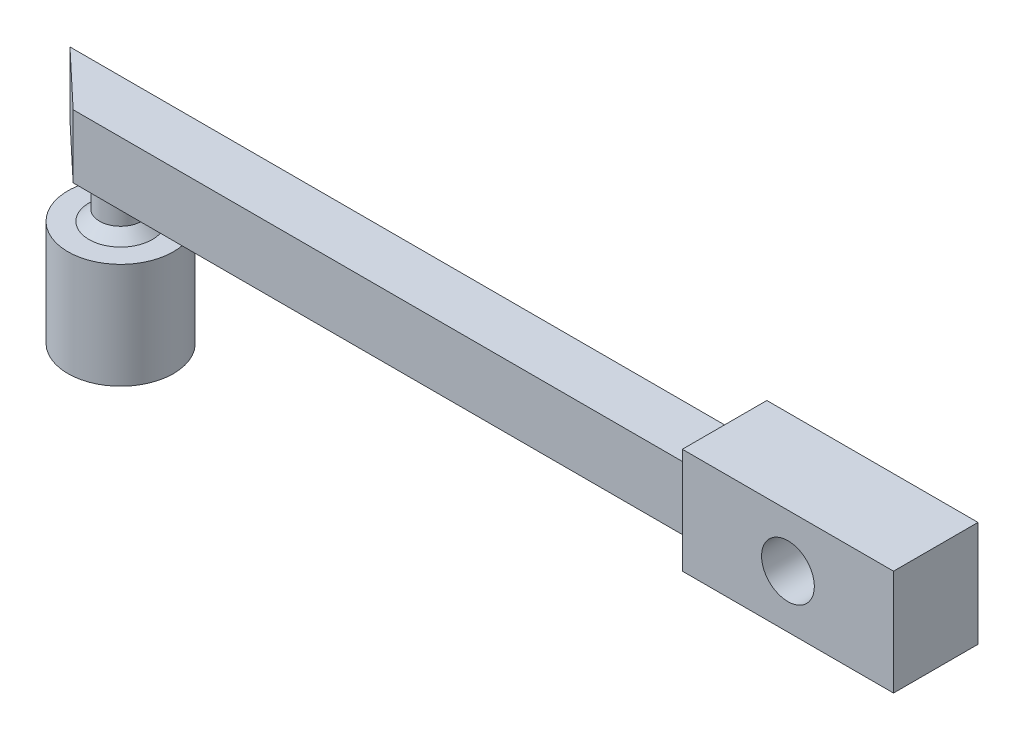
from build123d import *

# Parameters (mm, degrees)
SCHIZZO1_W                   = 33
SCHIZZO1_H                   = 3
ESTRUSIONE_ESTRUSIONE1_DEPTH = 2.5
TAGLIO_ESTRUSIONE1_DEPTH     = 17.955824958
SCHIZZO3_R                   = 1
ESTRUSIONE_ESTRUSIONE2_DEPTH = 1.7
SCHIZZO5_R                   = 2.5
ESTRUSIONE_ESTRUSIONE3_DEPTH = 5
SMUSSO2_SIZE                 = 0.5
SCHIZZO8_W                   = 4
SCHIZZO8_H                   = 5
ESTRUSIONE_ESTRUSIONE6_DEPTH = 10
SCHIZZO9_R                   = 1.25
TAGLIO_ESTRUSIONE3_DEPTH     = 29.232118234


with BuildPart() as part:
    # Schizzo1 → Estrusione-Estrusione1 (new body)
    with BuildSketch(Plane.XY):
        Rectangle(SCHIZZO1_W, SCHIZZO1_H)
    extrude(amount=ESTRUSIONE_ESTRUSIONE1_DEPTH)

    # Schizzo2 → Taglio-Estrusione1 (cut, through all)
    with BuildSketch(Plane.XZ.offset(1.5)):
        Polygon((-16.5, 0), (-13.85, 2.5), (-16.5, 2.5), align=None)
    extrude(amount=-TAGLIO_ESTRUSIONE1_DEPTH, mode=Mode.SUBTRACT)

    # Schizzo3 → Estrusione-Estrusione2 (add)
    with BuildSketch(Plane.XZ.offset(1.5)):
        with Locations((-12.85, 1.25)):
            Circle(SCHIZZO3_R)
    extrude(amount=ESTRUSIONE_ESTRUSIONE2_DEPTH)

    # Schizzo5 → Estrusione-Estrusione3 (add)
    with BuildSketch(Plane.XZ.offset(3.2)):
        with Locations((-12.85, 1.25)):
            Circle(SCHIZZO5_R)
    extrude(amount=ESTRUSIONE_ESTRUSIONE3_DEPTH)

    # Smusso2
    smusso2_edges = [part.edges().sort_by_distance(p)[0] for p in [
        (-13.85, -3.2, 1.25),
    ]]
    chamfer(smusso2_edges, length=SMUSSO2_SIZE)

    # Schizzo8 → Estrusione-Estrusione6 (add)
    with BuildSketch(Plane(origin=(16.5, 0, 0), x_dir=(0, 0, -1), z_dir=(1, 0, 0))):
        with Locations((-2, 1)):
            Rectangle(SCHIZZO8_W, SCHIZZO8_H)
    extrude(amount=ESTRUSIONE_ESTRUSIONE6_DEPTH)

    # Schizzo9 → Taglio-Estrusione3 (cut, through all)
    with BuildSketch(Plane.XY.offset(4)):
        with Locations((21.5, 1)):
            Circle(SCHIZZO9_R)
    extrude(amount=-TAGLIO_ESTRUSIONE3_DEPTH, mode=Mode.SUBTRACT)


solid = part.part
